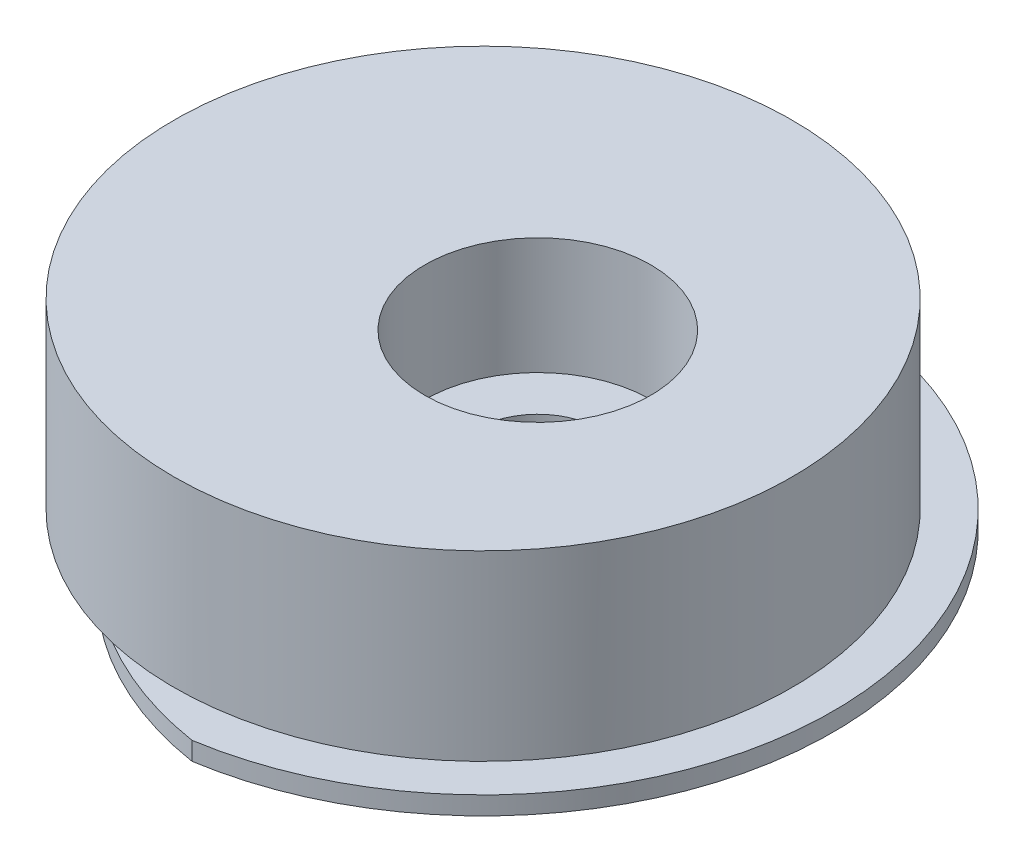
from build123d import *

# Parameters (mm, degrees)
BOSS_EXTRUDE1_DEPTH = 0.5
SKETCH2_R           = 8.475
BOSS_EXTRUDE2_DEPTH = 5
SKETCH3_R           = 1.65
SKETCH3_R_2         = 1.35
CUT_EXTRUDE1_DEPTH  = 4
SKETCH4_R           = 1.7
CUT_EXTRUDE2_DEPTH  = 15.82095223
SKETCH5_R           = 3.1
CUT_EXTRUDE3_DEPTH  = 3.2


with BuildPart() as part:
    # Sketch1 → Boss-Extrude1 (new body)
    with BuildSketch(Plane(origin=(0, 0, 0), x_dir=(1, 0, 0), z_dir=(0, 1, 0))):
        with BuildLine():
            ThreePointArc((8.1, 0), (5.799315036, 6.235382907), (0, 9.482088378))
            ThreePointArc((0, 9.482088378), (-8.1, 0), (0, -9.482088378))
            ThreePointArc((0, -9.482088378), (5.799315036, -6.235382907), (8.1, 0))
        make_face()
    extrude(amount=BOSS_EXTRUDE1_DEPTH)

    # Sketch2 → Boss-Extrude2 (add)
    with BuildSketch(Plane(origin=(0, 0.5, 0), x_dir=(1, 0, 0), z_dir=(0, 1, 0))):
        with Locations((-1.5, 0)):
            Circle(SKETCH2_R)
    extrude(amount=BOSS_EXTRUDE2_DEPTH)

    # Sketch3 → Cut-Extrude1 (cut)
    with BuildSketch(Plane(origin=(0, 0, 0), x_dir=(1, 0, 0), z_dir=(0, 1, 0))):
        with Locations((0, 5.8)):
            Circle(SKETCH3_R)
        with Locations((0, -5.8)):
            Circle(SKETCH3_R_2)
    extrude(amount=CUT_EXTRUDE1_DEPTH, mode=Mode.SUBTRACT)

    # Sketch4 → Cut-Extrude2 (cut, through all)
    with BuildSketch(Plane(origin=(0, 5.5, 0), x_dir=(1, 0, 0), z_dir=(0, 1, 0))):
        Circle(SKETCH4_R)
    extrude(amount=-CUT_EXTRUDE2_DEPTH, mode=Mode.SUBTRACT)

    # Sketch5 → Cut-Extrude3 (cut)
    with BuildSketch(Plane(origin=(0, 5.5, 0), x_dir=(1, 0, 0), z_dir=(0, 1, 0))):
        Circle(SKETCH5_R)
    extrude(amount=-CUT_EXTRUDE3_DEPTH, mode=Mode.SUBTRACT)


solid = part.part
